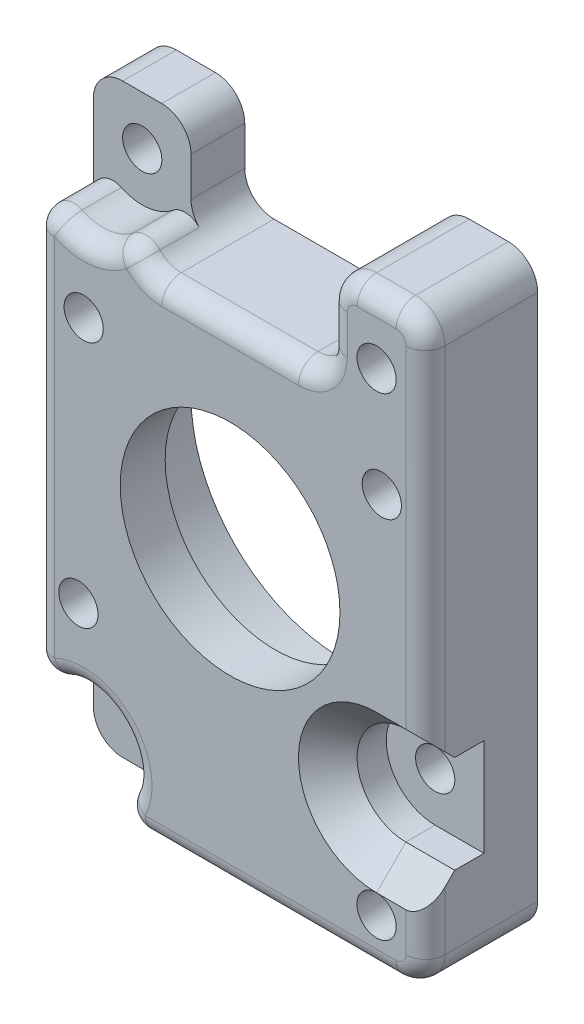
from build123d import *

# Parameters (mm, degrees)
SKETCH1_R           = 2.5527
SKETCH1_R_2         = 19.685
SKETCH1_W           = 12.7
SKETCH1_H           = 12.7
BOSS_EXTRUDE1_DEPTH = 14.605
CUT_EXTRUDE1_DEPTH  = 6.35
BOSS_EXTRUDE2_START = -5.842
SKETCH3_R           = 19.685
SKETCH3_R_2         = 14.2875
BOSS_EXTRUDE2_DEPTH = 5.842
SKETCH4_R           = 2.5527
CUT_EXTRUDE2_DEPTH  = 93.738266239
CUT_EXTRUDE3_DEPTH  = 6.35
CUT_EXTRUDE4_START  = -7.62
SKETCH8_R           = 2.5527
CUT_EXTRUDE4_DEPTH  = 7.62
FILLET1_R           = 3.81
FILLET3_R           = 0.0635
FILLET4_START       = 6.985
FILLET4_DEPTH       = 9.015
CHAMFER1_SIZE       = 3.81
FILLET5_R           = 2.54


with BuildPart() as part:
    # Sketch1 → Boss-Extrude1 (new body)
    # profile 1 of 3: a face of its own
    with BuildSketch(Plane.XY):
        Polygon((0, 63.5), (0, 0), (50.8, 0), (50.8, 63.5), (38.1, 63.5), (12.7, 63.5), align=None)
        with Locations(Location((6.35, 6.35, 0), (0, 0, 180))):
            Circle(SKETCH1_R, mode=Mode.SUBTRACT)
        with Locations(Location((5.668864874, 22.104928677, 0), (0, 0, 180))):
            Circle(SKETCH1_R, mode=Mode.SUBTRACT)
        with Locations(Location((44.45, 6.35, 0), (0, 0, 180))):
            Circle(SKETCH1_R, mode=Mode.SUBTRACT)
        with Locations(Location((44.45, 19.05, 0), (0, 0, 180))):
            Circle(SKETCH1_R, mode=Mode.SUBTRACT)
        with Locations(Location((25.4, 38.1, 0), (0, 0, 180))):
            Circle(SKETCH1_R_2, mode=Mode.SUBTRACT)
        with Locations(Location((45.131135126, 54.095071323, 0), (0, 0, 180))):
            Circle(SKETCH1_R, mode=Mode.SUBTRACT)
    # profile 2 of 3: a face of its own
    with BuildSketch(Plane.XY):
        with Locations((6.35, 69.85)):
            Rectangle(SKETCH1_W, SKETCH1_H)
        with Locations(Location((6.35, 69.85, 0), (0, 0, 180))):
            Circle(SKETCH1_R, mode=Mode.SUBTRACT)
    # profile 3 of 3: a face of its own
    with BuildSketch(Plane.XY):
        with Locations((44.45, 69.85)):
            Rectangle(SKETCH1_W, SKETCH1_H)
        with Locations(Location((44.45, 67.945, 0), (0, 0, 180))):
            Circle(SKETCH1_R, mode=Mode.SUBTRACT)
    extrude(amount=BOSS_EXTRUDE1_DEPTH)

    # Sketch2 → Cut-Extrude1 (cut)
    with BuildSketch(Plane(origin=(0, 0, 0), x_dir=(-1, 0, 0), z_dir=(0, 0, -1))):
        Polygon((-41.45488381, 58.476257037), (-47.087227595, 59.469391211), (-50.763478911, 55.088205497), (-48.807386443, 49.713885609), (-43.175042658, 48.720751435), (-39.498791341, 53.101937149), align=None)
        Polygon((-1.992613557, 26.486114391), (-7.624957342, 27.479248565), (-11.301208659, 23.098062851), (-9.34511619, 17.723742963), (-3.712772405, 16.730608789), (-0.036521089, 21.111794503), align=None)
        Polygon((-41.590384117, 11.303), (-47.309615883, 11.303), (-50.169231767, 6.35), (-47.309615883, 1.397), (-41.590384117, 1.397), (-38.730768233, 6.35), align=None)
        Polygon((-44.45, 73.664231767), (-49.403, 70.804615883), (-49.403, 65.085384117), (-44.45, 62.225768233), (-39.497, 65.085384117), (-39.497, 70.804615883), align=None)
    extrude(amount=-CUT_EXTRUDE1_DEPTH, mode=Mode.SUBTRACT)

    # Sketch3 → Boss-Extrude2 (add)
    with BuildSketch(Plane.XY.offset(14.605).offset(BOSS_EXTRUDE2_START)):
        with Locations(Location((25.4, 38.1, 0), (0, 0, 180))):
            Circle(SKETCH3_R)
        with Locations((25.4, 38.1)):
            Circle(SKETCH3_R_2, mode=Mode.SUBTRACT)
    extrude(amount=BOSS_EXTRUDE2_DEPTH)

    # Sketch4 → Cut-Extrude2 (cut, through all)
    with BuildSketch(Plane.XY.offset(14.605)):
        with Locations((6.35, 54.61)):
            Circle(SKETCH4_R)
    extrude(amount=-CUT_EXTRUDE2_DEPTH, mode=Mode.SUBTRACT)

    # Sketch5 → Cut-Extrude3 (cut)
    with BuildSketch(Plane(origin=(0, 0, 0), x_dir=(-1, 0, 0), z_dir=(0, 0, -1))):
        Polygon((-2.673748684, 50.228814286), (-0.717656215, 55.603134174), (-4.393907531, 59.984319888), (-10.026251316, 58.991185714), (-11.982343785, 53.616865826), (-8.306092469, 49.235680112), align=None)
    extrude(amount=-CUT_EXTRUDE3_DEPTH, mode=Mode.SUBTRACT)

    # Sketch8 → Cut-Extrude4 (cut)
    # profile 1 of 3: a face of its own
    with BuildSketch(Plane.XY.offset(14.605).offset(CUT_EXTRUDE4_START)):
        with BuildLine():
            Line((0, 76.2), (0, 69.85))
            ThreePointArc((0, 69.85), (6.35, 63.5), (12.7, 69.85))
            Line((12.7, 69.85), (12.7, 76.2))
            Line((12.7, 76.2), (0, 76.2))
        make_face()
        with Locations(Location((6.35, 69.85, 0), (0, 0, 180))):
            Circle(SKETCH8_R, mode=Mode.SUBTRACT)
    # profile 2 of 3: a face of its own
    with BuildSketch(Plane.XY.offset(14.605).offset(CUT_EXTRUDE4_START)):
        with BuildLine():
            Line((50.8, 25.4), (44.45, 25.4))
            ThreePointArc((44.45, 25.4), (38.1, 19.05), (44.45, 12.7))
            Line((44.45, 12.7), (50.8, 12.7))
            Line((50.8, 12.7), (50.8, 25.4))
        make_face()
        with Locations(Location((44.45, 19.05, 0), (0, 0, 180))):
            Circle(SKETCH8_R, mode=Mode.SUBTRACT)
    # profile 3 of 3: a face of its own
    with BuildSketch(Plane.XY.offset(14.605).offset(CUT_EXTRUDE4_START)):
        with BuildLine():
            Line((0, 0), (6.35, 0))
            ThreePointArc((6.35, 0), (10.840128061, 10.840128061), (0, 6.35))
            Line((0, 6.35), (0, 0))
        make_face()
        with Locations(Location((6.35, 6.35, 0), (0, 0, 180))):
            Circle(SKETCH8_R, mode=Mode.SUBTRACT)
    extrude(amount=CUT_EXTRUDE4_DEPTH, mode=Mode.SUBTRACT)

    # Fillet1
    fillet1_edges = [part.edges().sort_by_distance(p)[0] for p in [
        (0, 0, 3.4925),
        (0, 76.2, 3.4925),
        (12.7, 76.2, 3.4925),
        (12.7, 63.5, 7.3025),
        (38.1, 63.5, 7.3025),
        (38.1, 76.2, 7.3025),
        (50.8, 76.2, 7.3025),
        (50.8, 0, 7.3025),
    ]]
    fillet(fillet1_edges, radius=FILLET1_R)

    # Fillet3
    fillet3_edges = [part.edges().sort_by_distance(p)[0] for p in [
        (45.085, 38.1, 8.763),
    ]]
    fillet(fillet3_edges, radius=FILLET3_R)

    # Fillet4: read off the stored shape, not the designer's step
    # Fillet4 outline → Fillet4 (cut)
    with BuildSketch(Plane.XY.offset(FILLET4_START)):
        with BuildLine():
            ThreePointArc((14.382185257, 0), (12.23549345, 1.182312891), (12.087275183, 3.628571429))
            ThreePointArc((12.087275183, 3.628571429), (9.744217773, 0.983270482), (6.35, 0))
            Line((6.35, 0), (14.382185257, 0))
        make_face()
        with BuildLine():
            ThreePointArc((3.628571429, 12.087275183), (1.182312891, 12.23549345), (0, 14.382185257))
            Line((0, 14.382185257), (0, 6.35))
            ThreePointArc((0, 6.35), (0.983270482, 9.744217773), (3.628571429, 12.087275183))
        make_face()
        with BuildLine():
            ThreePointArc((0, 61.817814743), (1.182312891, 63.96450655), (3.628571429, 64.112724817))
            ThreePointArc((3.628571429, 64.112724817), (0.983270483, 66.455782228), (0, 69.85))
            Line((0, 69.85), (0, 61.817814743))
        make_face()
        with BuildLine():
            ThreePointArc((12.7, 69.85), (12.076615103, 67.106210748), (10.328856864, 64.901141742))
            ThreePointArc((10.328856864, 64.901141742), (12.086184936, 65.456182276), (13.756239766, 64.676959064))
            ThreePointArc((13.756239766, 64.676959064), (12.973905651, 65.891501938), (12.7, 67.31))
            Line((12.7, 67.31), (12.7, 69.85))
        make_face()
    extrude(amount=FILLET4_DEPTH, mode=Mode.SUBTRACT)

    # Chamfer1
    # the kernel refuses this chamfer: 3.81 mm, written as the material it takes off along each edge
    with BuildSketch(Plane(origin=(60.598112184, 25.4, 14.605), x_dir=(0, 1, 0), z_dir=(-1, 0, 0)), Plane(origin=(44.45, 12.7, 14.605), x_dir=(0, -1, 0), z_dir=(1, 0, 0))) as chamfer1_piece_1:
        Polygon((CHAMFER1_SIZE, 0), (0, CHAMFER1_SIZE), (0, 0), align=None)
    extrude(amount=16.148112184, mode=Mode.SUBTRACT)
    with BuildSketch(Plane(origin=(44.45, 19.05, 14.605), x_dir=(0, 1, 0), z_dir=(1, 0, 0))) as chamfer1_piece_2:
        Polygon((6.35 + CHAMFER1_SIZE, 0), (6.35, -CHAMFER1_SIZE), (6.35, 0), align=None)
    revolve(axis=Axis((44.45, 19.05, 14.605), (0, 0, 1)), revolution_arc=180, mode=Mode.SUBTRACT)

    # Fillet5
    fillet5_edges = [part.edges().sort_by_distance(p)[0] for p in [
        (25.4, 63.5, 14.605),
        (50.8, 6.35, 14.605),
        (44.45, 76.2, 14.605),
        (38.1, 69.85, 14.605),
        (39.215923164, 75.084076836, 14.605),
        (49.684076836, 75.084076836, 14.605),
        (49.684076836, 1.115923164, 14.605),
        (15.012633306, 63.806574108, 14.605),
        (36.984076836, 64.615923164, 14.605),
        (7.092079369, 63.543509834, 14.605),
        (30.686092628, 0, 14.605),
        (0, 38.1, 14.605),
        (10.840128061, 10.840128061, 14.605),
        (1.182312891, 12.23549345, 14.605),
        (12.23549345, 1.182312891, 14.605),
        (12.086184936, 65.456182276, 14.605),
        (1.182312891, 63.96450655, 14.605),
        (50.8, 50.8, 14.605),
    ]]
    fillet(fillet5_edges, radius=FILLET5_R)


solid = part.part
